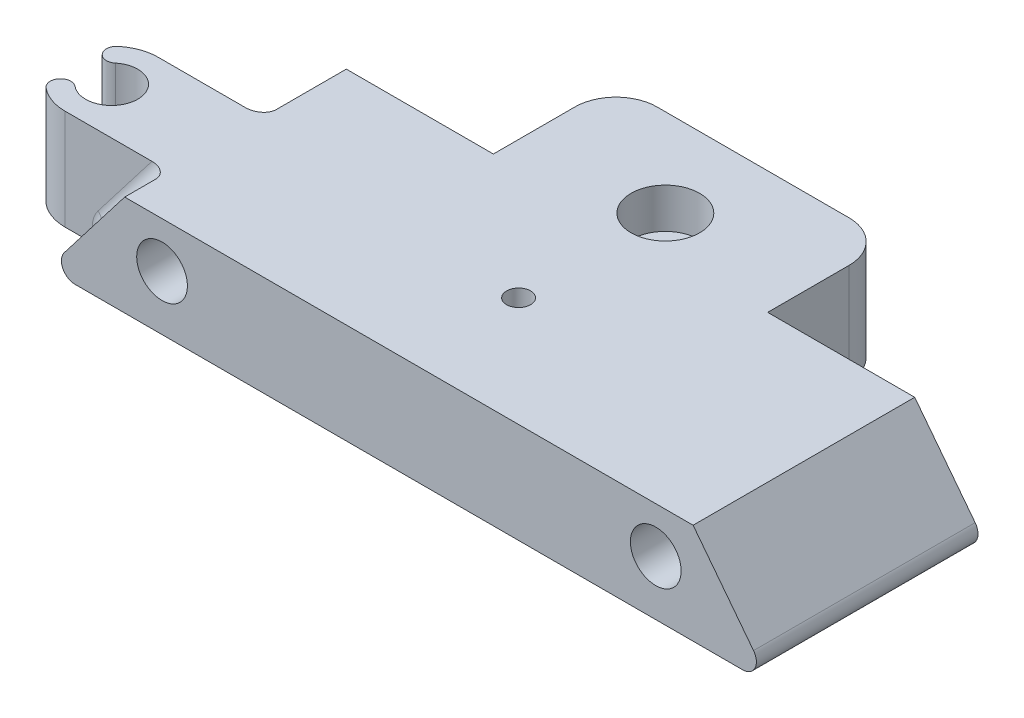
from build123d import *

# Parameters (mm, degrees)
BOSS_EXTRUDE1_DEPTH      = 4.425
BOSS_EXTRUDE1_DEPTH_BACK = 2.9
CUT_EXTRUDE1_DEPTH       = 34.079090828
SKETCH6_R                = 1.3
CUT_EXTRUDE2_DEPTH       = 34.590195742
SKETCH7_R                = 2.5
CUT_EXTRUDE3_DEPTH       = 2.925
SKETCH8_R                = 0.875
CUT_EXTRUDE4_DEPTH       = 34.079090828
SKETCH9_R                = 1.85
CUT_EXTRUDE5_DEPTH       = 32.712487288
CUT_EXTRUDE6_DEPTH       = 38.074873567
FILLET1_R                = 1
FILLET2_R                = 3
BOSS_EXTRUDE2_DEPTH      = 7.325
FILLET3_R                = 1


with BuildPart() as part:
    # Sketch4 → Boss-Extrude1 (new, two sides: drawn at the far end of the back side and taken through both)
    with BuildSketch(Plane(origin=(0, 0, 0), x_dir=(1, 0, 0), z_dir=(0, 1, 0)).offset(-BOSS_EXTRUDE1_DEPTH_BACK)):
        Polygon((-26.925, -2.54), (-10.000436291, -2.54), (-10.000436291, 6.4), (10.000436291, 6.4), (10.000436291, -2.54), (26.925, -2.54), (26.925, -18.7), (-26.925, -18.7), align=None)
    extrude(amount=BOSS_EXTRUDE1_DEPTH + BOSS_EXTRUDE1_DEPTH_BACK)

    # Sketch5 → Cut-Extrude1 (cut, through all)
    with BuildSketch(Plane(origin=(0, 0, 0), x_dir=(1, 0, 0), z_dir=(0, 1, 0))):
        with BuildLine():
            Line((2.004851846, -13.98376743), (2.839866559, -2.339399967))
            ThreePointArc((2.839866559, -2.339399967), (2.881992781, -2.129359863), (2.975294921, -1.936522692))
            ThreePointArc((2.975294921, -1.936522692), (0, 3.55), (-2.975294921, -1.936522692))
            ThreePointArc((-2.975294921, -1.936522692), (-2.881992781, -2.129359863), (-2.839866559, -2.339399967))
            Line((-2.839866559, -2.339399967), (-2.004851846, -13.98376743))
            ThreePointArc((-2.004851846, -13.98376743), (0, -15.85), (2.004851846, -13.98376743))
        make_face()
    extrude(amount=-CUT_EXTRUDE1_DEPTH, mode=Mode.SUBTRACT)

    # Sketch6 → Cut-Extrude2 (cut, through all)
    with BuildSketch(Plane(origin=(0, 4.425, 0), x_dir=(1, 0, 0), z_dir=(0, 1, 0))):
        with Locations(Location((0, 0, 0), (0, 0, 270))):
            Circle(SKETCH6_R)
    extrude(amount=-CUT_EXTRUDE2_DEPTH, mode=Mode.SUBTRACT)

    # Sketch7 → Cut-Extrude3 (cut)
    with BuildSketch(Plane(origin=(0, 4.425, 0), x_dir=(1, 0, 0), z_dir=(0, 1, 0))):
        with Locations(Location((0, 0, 0), (0, 0, 270))):
            Circle(SKETCH7_R)
    extrude(amount=-CUT_EXTRUDE3_DEPTH, mode=Mode.SUBTRACT)

    # Sketch8 → Cut-Extrude4 (cut, through all)
    with BuildSketch(Plane.XZ):
        with Locations(Location((0, 10.7, 0), (0, 0, 270))):
            Circle(SKETCH8_R)
    extrude(amount=-CUT_EXTRUDE4_DEPTH, mode=Mode.SUBTRACT)

    # Sketch9 → Cut-Extrude5 (cut, through all)
    with BuildSketch(Plane(origin=(0, 0, 2.54), x_dir=(-1, 0, 0), z_dir=(0, 0, -1))):
        with Locations((18, 1.1)):
            Circle(SKETCH9_R)
        with Locations((-18, 1.1)):
            Circle(SKETCH9_R)
    extrude(amount=-CUT_EXTRUDE5_DEPTH, mode=Mode.SUBTRACT)

    # Sketch11 → Cut-Extrude6 (cut, through all)
    with BuildSketch(Plane.XY.offset(18.7)):
        Polygon((-20.723540873, 4.425), (-26.372623028, -2.9), (-26.925, -2.9), (-26.925, 4.425), align=None)
        Polygon((20.723540873, 4.425), (26.925, 4.425), (26.925, -2.9), (26.372623028, -2.9), align=None)
    extrude(amount=-CUT_EXTRUDE6_DEPTH, mode=Mode.SUBTRACT)

    # Fillet1
    fillet1_edges = [part.edges().sort_by_distance(p)[0] for p in [
        (26.372623028, -2.9, 10.62),
        (-26.372623028, -2.9, 10.62),
    ]]
    fillet(fillet1_edges, radius=FILLET1_R)

    # Fillet2
    fillet2_edges = [part.edges().sort_by_distance(p)[0] for p in [
        (-10.000436291, 0.7625, -6.4),
        (10.000436291, 0.7625, -6.4),
    ]]
    fillet(fillet2_edges, radius=FILLET2_R)

    # Sketch14 → Boss-Extrude2 (add, through all)
    with BuildSketch(Plane(origin=(0, 4.425, 0), x_dir=(1, 0, 0), z_dir=(0, 1, 0))):
        with BuildLine():
            Line((-20.723540873, -8.65), (-28.322297461, -8.65))
            ThreePointArc((-28.322297461, -8.65), (-29.466272656, -8.848231621), (-30.476852522, -9.419811321))
            ThreePointArc((-30.476852522, -9.419811321), (-30.581771703, -10.475269499), (-29.526313525, -10.580188679))
            ThreePointArc((-29.526313525, -10.580188679), (-26.422297461, -12.05), (-29.526313525, -13.519811321))
            ThreePointArc((-29.526313525, -13.519811321), (-30.581771703, -13.624730501), (-30.476852522, -14.680188679))
            ThreePointArc((-30.476852522, -14.680188679), (-29.466272656, -15.251768379), (-28.322297461, -15.45))
            Line((-28.322297461, -15.45), (-20.723540873, -15.45))
            Line((-20.723540873, -15.45), (-20.723540873, -8.65))
        make_face()
    extrude(amount=-BOSS_EXTRUDE2_DEPTH)

    # Fillet3
    # the kernel refuses this fillet: 1 mm, written as the material it adds along each edge
    with BuildSketch(Plane(origin=(-24.338579866, -1.9, 8.65), x_dir=(0.5968522081551058, 0.8023511959362772, 0), z_dir=(-0.8023511959362772, 0.5968522081551058, 0))) as fillet3_piece_1_section:
        with BuildLine():
            CenterArc((1 + FILLET3_R, FILLET3_R), FILLET3_R, 180, 90)
            Line((1, FILLET3_R), (1, 0))
            Line((1, 0), (1 + FILLET3_R, 0))
        make_face()
    fillet3_piece_1 = revolve(axis=Axis((-24.338579866, -1.9, 8.65), (0, 0, -1)), revolution_arc=270.994831495, mode=Mode.PRIVATE)
    fillet3_piece_1 = split(fillet3_piece_1, bisect_by=Plane(origin=(-25.318581696, -2.9, 8.393059432), z_dir=(0, 1, 0)), keep=Keep.TOP, mode=Mode.PRIVATE)
    add(fillet3_piece_1)
    with BuildSketch(Plane(origin=(-24.338579866, -1.9, 15.45), x_dir=(0.5968522081551029, 0.8023511959362795, 0), z_dir=(-0.8023511959362795, 0.5968522081551029, 0))) as fillet3_piece_2_section:
        with BuildLine():
            CenterArc((1 + FILLET3_R, -FILLET3_R), FILLET3_R, 90, 90)
            Line((1 + FILLET3_R, 0), (1, 0))
            Line((1, 0), (1, -FILLET3_R))
        make_face()
    fillet3_piece_2 = revolve(axis=Axis((-24.338579866, -1.9, 15.45), (0, 0, -1)), revolution_arc=270.994831495, mode=Mode.PRIVATE)
    fillet3_piece_2 = split(fillet3_piece_2, bisect_by=Plane(origin=(-25.318581739, -2.9, 15.706940487), z_dir=(0, 1, 0)), keep=Keep.TOP, mode=Mode.PRIVATE)
    add(fillet3_piece_2)
    with BuildSketch(Plane(origin=(-25.130447445, -1.289307166, 15.45), x_dir=(0, 0, 1), z_dir=(0.6106928339923638, 0.7918675788983757, 0))) as fillet3_piece_3_section:
        with BuildLine():
            CenterArc((FILLET3_R, -FILLET3_R), FILLET3_R, 90, 90)
            Line((0, -FILLET3_R), (0, 0))
            Line((0, 0), (FILLET3_R, 0))
        make_face()
    fillet3_piece_3 = extrude(amount=9.716240844, mode=Mode.PRIVATE)
    fillet3_piece_3 = split(fillet3_piece_3, bisect_by=Plane(origin=(-23.152517153, 4.425, 15.675632439), z_dir=(0, -1, 0)), keep=Keep.TOP, mode=Mode.PRIVATE)
    add(fillet3_piece_3)
    with BuildSketch(Plane(origin=(-19.196808788, 6.404668947, 8.65), x_dir=(0, 0, -1), z_dir=(-0.6106928339923638, -0.7918675788983757, 0))) as fillet3_piece_4_section:
        with BuildLine():
            CenterArc((FILLET3_R, -FILLET3_R), FILLET3_R, 90, 90)
            Line((0, -FILLET3_R), (0, 0))
            Line((0, 0), (FILLET3_R, 0))
        make_face()
    fillet3_piece_4 = extrude(amount=9.716240844, mode=Mode.PRIVATE)
    fillet3_piece_4 = split(fillet3_piece_4, bisect_by=Plane(origin=(-23.152517153, 4.425, 8.424367561), z_dir=(0, -1, 0)), keep=Keep.TOP, mode=Mode.PRIVATE)
    add(fillet3_piece_4)


solid = part.part
